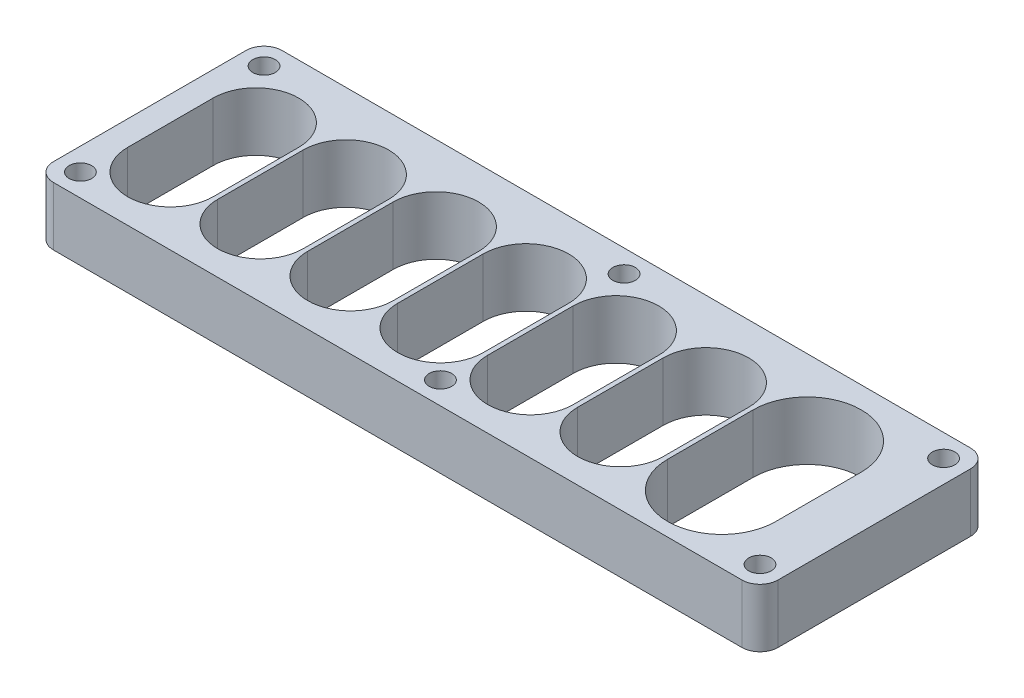
from build123d import *

# Parameters (mm, degrees)
SKETCH1_W                    = 161
SKETCH1_H                    = 50.8
BOSS_EXTRUDE1_DEPTH          = 13
CUT_EXTRUDE1_DEPTH           = 170.324067988
FILLET1_R                    = 4
F_5_0MM_DOWEL_HOLE1_D        = 5
F_9_0_9_DIAMETER_HOLE1_D     = 9
F_9_0_9_DIAMETER_HOLE1_DEPTH = 5
F_9_0_9_DIAMETER_HOLE1_TIP   = 2.703872786


with BuildPart() as part:
    # Sketch1 → Boss-Extrude1 (new body)
    with BuildSketch(Plane(origin=(0, 0, 0), x_dir=(1, 0, 0), z_dir=(0, 1, 0))):
        with Locations((-80.5, -25.4)):
            Rectangle(SKETCH1_W, SKETCH1_H)
    extrude(amount=BOSS_EXTRUDE1_DEPTH)

    # Sketch2 → Cut-Extrude1 (cut, through all)
    with BuildSketch(Plane(origin=(0, 13, 0), x_dir=(1, 0, 0), z_dir=(0, 1, 0))):
        with BuildLine():
            Line((-136.5, -16.8), (-136.5, -35.8))
            ThreePointArc((-136.5, -35.8), (-146, -45.3), (-155.5, -35.8))
            Line((-155.5, -35.8), (-155.5, -16.8))
            ThreePointArc((-155.5, -16.8), (-146, -7.3), (-136.5, -16.8))
        make_face()
        with BuildLine():
            Line((-116.5, -16.8), (-116.5, -35.8))
            ThreePointArc((-116.5, -35.8), (-126, -45.3), (-135.5, -35.8))
            Line((-135.5, -35.8), (-135.5, -16.8))
            ThreePointArc((-135.5, -16.8), (-126, -7.3), (-116.5, -16.8))
        make_face()
        with BuildLine():
            Line((-96.5, -16.8), (-96.5, -35.8))
            ThreePointArc((-96.5, -35.8), (-106, -45.3), (-115.5, -35.8))
            Line((-115.5, -35.8), (-115.5, -16.8))
            ThreePointArc((-115.5, -16.8), (-106, -7.3), (-96.5, -16.8))
        make_face()
        with BuildLine():
            Line((-76.5, -16.8), (-76.5, -35.8))
            ThreePointArc((-76.5, -35.8), (-86, -45.3), (-95.5, -35.8))
            Line((-95.5, -35.8), (-95.5, -16.8))
            ThreePointArc((-95.5, -16.8), (-86, -7.3), (-76.5, -16.8))
        make_face()
        with BuildLine():
            Line((-56.5, -16.8), (-56.5, -35.8))
            ThreePointArc((-56.5, -35.8), (-66, -45.3), (-75.5, -35.8))
            Line((-75.5, -35.8), (-75.5, -16.8))
            ThreePointArc((-75.5, -16.8), (-66, -7.3), (-56.5, -16.8))
        make_face()
        with BuildLine():
            Line((-36.5, -16.8), (-36.5, -35.8))
            ThreePointArc((-36.5, -35.8), (-46, -45.3), (-55.5, -35.8))
            Line((-55.5, -35.8), (-55.5, -16.8))
            ThreePointArc((-55.5, -16.8), (-46, -7.3), (-36.5, -16.8))
        make_face()
        with BuildLine():
            Line((-11.5, -16.8), (-11.5, -35.8))
            ThreePointArc((-11.5, -35.8), (-23.5, -47.8), (-35.5, -35.8))
            Line((-35.5, -35.8), (-35.5, -16.8))
            ThreePointArc((-35.5, -16.8), (-23.5, -4.8), (-11.5, -16.8))
        make_face()
    extrude(amount=-CUT_EXTRUDE1_DEPTH, mode=Mode.SUBTRACT)

    # Fillet1
    fillet1_edges = [part.edges().sort_by_distance(p)[0] for p in [
        (-161, 6.5, 0),
        (-161, 6.5, 50.8),
        (0, 6.5, 0),
        (0, 6.5, 50.8),
    ]]
    fillet(fillet1_edges, radius=FILLET1_R)

    # Ø5.0mm Dowel Hole1 (through all)
    with Locations(Plane(origin=(0, 13, 0), x_dir=(1, 0, 0), z_dir=(0, 1, 0))):
        with Locations((-156, -45.8), (-76, -45.8), (-5, -45.8), (-5, -5), (-76, -5), (-156, -5)):
            Hole(F_5_0MM_DOWEL_HOLE1_D / 2)

    # Ø9.0 (9) Diameter Hole1
    with Locations(Plane(origin=(0, 0, 0), x_dir=(-1, 0, 0), z_dir=(0, -1, 0))):
        with Locations((156, -45.8), (76, -45.8), (5, -45.8), (5, -5), (76, -5), (156, -5)):
            Hole(F_9_0_9_DIAMETER_HOLE1_D / 2, depth=F_9_0_9_DIAMETER_HOLE1_DEPTH)
            with Locations((0, 0, -(F_9_0_9_DIAMETER_HOLE1_DEPTH + F_9_0_9_DIAMETER_HOLE1_TIP / 2))):  # 118° drill point
                Cone(0, F_9_0_9_DIAMETER_HOLE1_D / 2, F_9_0_9_DIAMETER_HOLE1_TIP, mode=Mode.SUBTRACT)


solid = part.part
